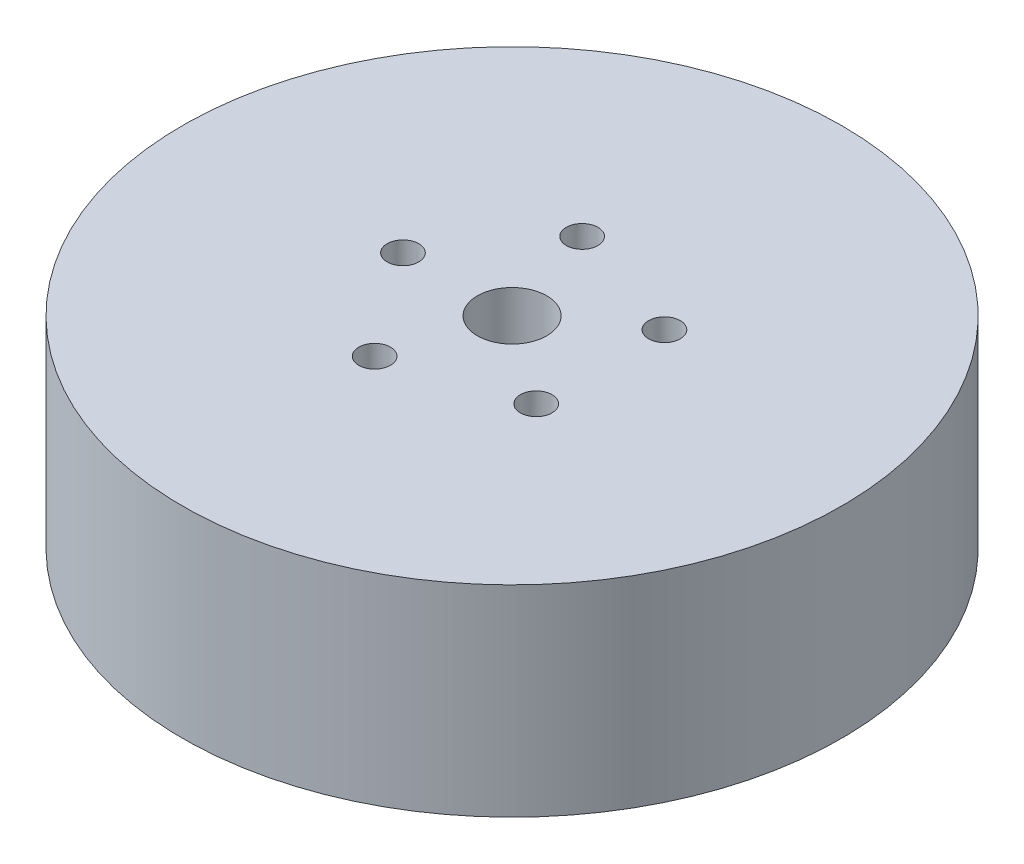
from build123d import *

# Parameters (mm, degrees)
SKETCH1_R           = 47.5
BOSS_EXTRUDE1_DEPTH = 29
SKETCH2_R           = 5
CUT_EXTRUDE1_DEPTH  = 74.167615787
SKETCH3_R           = 2.279921831
CUT_EXTRUDE2_DEPTH  = 27.360476295
CIRPATTERN1_COUNT   = 5


with BuildPart() as part:
    # Sketch1 → Boss-Extrude1 (new body)
    with BuildSketch(Plane(origin=(0, 0, 0), x_dir=(1, 0, 0), z_dir=(0, 1, 0))):
        Circle(SKETCH1_R)
    extrude(amount=BOSS_EXTRUDE1_DEPTH)

    # Sketch2 → Cut-Extrude1 (cut, through all)
    with BuildSketch(Plane(origin=(0, 0, 0), x_dir=(1, 0, 0), z_dir=(0, 1, 0))):
        Circle(SKETCH2_R)
    extrude(amount=CUT_EXTRUDE1_DEPTH, mode=Mode.SUBTRACT)

    # Sketch3 → Cut-Extrude2 (cut)
    with BuildSketch(Plane(origin=(0, 29, 0), x_dir=(1, 0, 0), z_dir=(0, 1, 0))):
        with Locations((-15.723664714, 0)):
            Circle(SKETCH3_R)
    cut_extrude2 = extrude(amount=-CUT_EXTRUDE2_DEPTH, mode=Mode.SUBTRACT)

    # CirPattern1: Cut-Extrude2 ×5 about axis
    cirpattern1_axis = Axis((0, 0, 0), (0, 1, 0))
    for i in range(1, CIRPATTERN1_COUNT):
        add(cut_extrude2.rotate(cirpattern1_axis, i * 360 / CIRPATTERN1_COUNT), mode=Mode.SUBTRACT)


solid = part.part
